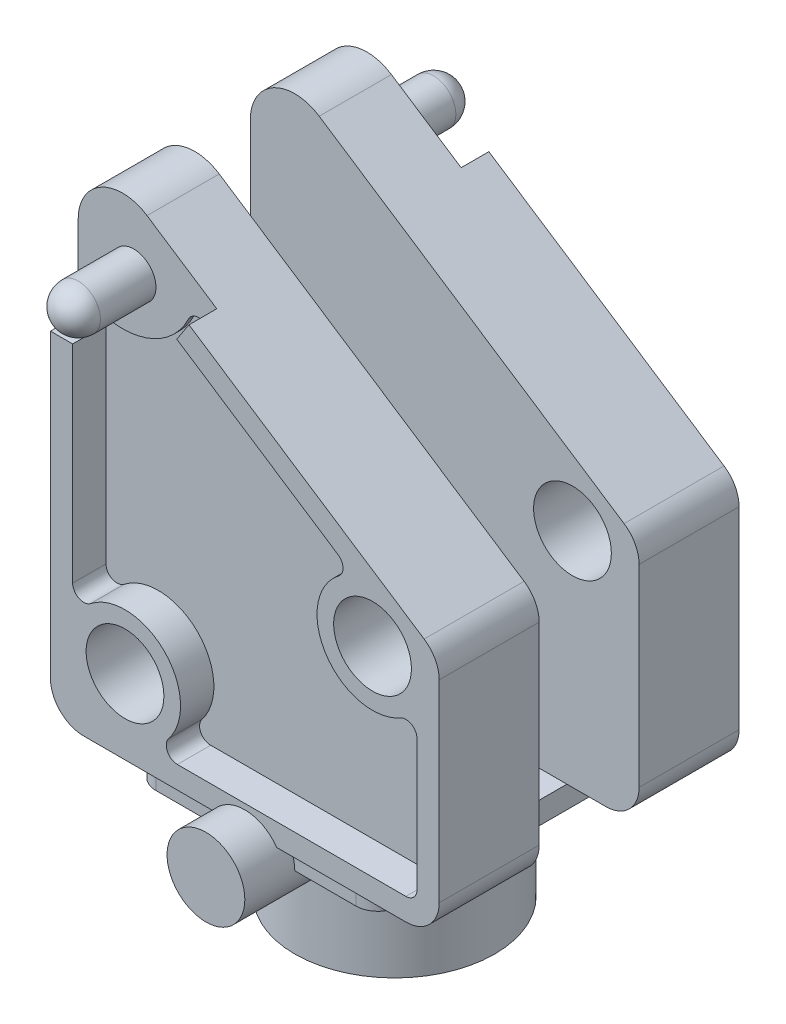
from build123d import *

# Parameters (mm, degrees)
BOSS_EXTRUDE1_DEPTH            = 22
SKETCH2_W                      = 35
SKETCH2_H                      = 22
BOSS_EXTRUDE2_DEPTH            = 24
BOSS_EXTRUDE3_DEPTH            = 1.5
BOSS_EXTRUDE4_START            = 2.5
BOSS_EXTRUDE4_DEPTH            = 2.5
CUT_EXTRUDE1_DEPTH             = 9
SKETCH6_W                      = 35
SKETCH6_H                      = 0.8
CUT_EXTRUDE2_DEPTH             = 2
SKETCH7_W                      = 2
SKETCH7_H                      = 1.5
CUT_EXTRUDE3_DEPTH             = 7.510590912
SKETCH8_W                      = 1.5
SKETCH8_H                      = 2
CUT_EXTRUDE4_DEPTH             = 7.510590912
SKETCH9_W                      = 2
SKETCH9_H                      = 2.5
CUT_EXTRUDE5_DEPTH             = 7.510590912
SKETCH10_W                     = 2.5
SKETCH10_H                     = 2
CUT_EXTRUDE6_DEPTH             = 7.510590912
CUT_EXTRUDE7_DEPTH             = 6.5
CUT_EXTRUDE8_DEPTH             = 6.5
BOSS_EXTRUDE5_DEPTH            = 1
CUT_EXTRUDE9_DEPTH             = 0.5
CUT_EXTRUDE10_START            = -0.5
CUT_EXTRUDE10_DEPTH            = 0.5
SKETCH16_R                     = 9
BOSS_EXTRUDE6_DEPTH            = 10
F_17_0_17_DIAMETER_HOLE1_D     = 17
F_17_0_17_DIAMETER_HOLE1_DEPTH = 10
BOSS_EXTRUDE7_REACH            = 61.982
BOSS_EXTRUDE7_END_RADIUS       = 8.5
SKETCH22_W                     = 3.5
SKETCH22_H                     = 8.5
F_7_0_7_DIAMETER_HOLE1_D       = 7
F_7_0_7_DIAMETER_HOLE1_DEPTH   = 9
F_7_0_7_DIAMETER_HOLE2_D       = 7
F_7_0_7_DIAMETER_HOLE2_DEPTH   = 13.5
FILLET1_R                      = 1
FILLET2_R                      = 2
FILLET3_R                      = 3


# Read off the part's stored shape, not the designer's step: Boss-Extrude8, Boss-Extrude9
with BuildPart() as part:
    # Sketch1 → Boss-Extrude1 (new body)
    with BuildSketch(Plane.XY.offset(11)):
        with BuildLine():
            Line((-17.5, 34), (17.5, 34))
            Line((17.5, 34), (-11.303288453, 52.927875269))
            ThreePointArc((-11.303288453, 52.927875269), (-15.399098972, 53.105482741), (-17.5, 49.585053351))
            Line((-17.5, 49.585053351), (-17.5, 34))
        make_face()
    extrude(amount=-BOSS_EXTRUDE1_DEPTH)

    # Sketch2 → Boss-Extrude2 (add)
    with BuildSketch(Plane.XZ.offset(-34)):
        Rectangle(SKETCH2_W, SKETCH2_H)
    extrude(amount=BOSS_EXTRUDE2_DEPTH)

    # Sketch3 → Boss-Extrude3 (add)
    with BuildSketch(Plane.XY.offset(11)):
        with BuildLine():
            Line((17.5, 10), (-17.5, 10))
            Line((-17.5, 10), (-17.5, 49.585053351))
            Line((-17.5, 49.585053351), (-15.5, 49.585053351))
            Line((-15.5, 49.585053351), (-15.5, 23.426149773))
            ThreePointArc((-15.5, 23.426149773), (-14.936551363, 22.526470437), (-13.881154186, 22.640637292))
            ThreePointArc((-13.881154186, 22.640637292), (-7.251391207, 22.248608793), (-6.859362708, 15.618845814))
            ThreePointArc((-6.859362708, 15.618845814), (-6.973529563, 14.563448637), (-6.073850227, 14))
            Line((-6.073850227, 14), (15.5, 14))
            Line((15.5, 14), (15.5, 26.803847577))
            ThreePointArc((15.5, 26.803847577), (15, 27.669872981), (14, 27.669872981))
            ThreePointArc((14, 27.669872981), (7.344042027, 29.220069546), (8.452225776, 35.963719501))
            ThreePointArc((8.452225776, 35.963719501), (8.841984311, 36.793514293), (8.391848818, 37.592168881))
            Line((8.391848818, 37.592168881), (-12.401644227, 51.25646431))
            Line((-12.401644227, 51.25646431), (-11.303288453, 52.927875269))
            Line((-11.303288453, 52.927875269), (17.5, 34))
            Line((17.5, 34), (17.5, 10))
        make_face()
    extrude(amount=BOSS_EXTRUDE3_DEPTH)

    # Sketch4 → Boss-Extrude4 (add)
    with BuildSketch(Plane(origin=(0, 0, -11), x_dir=(-1, 0, 0), z_dir=(0, 0, -1)).offset(BOSS_EXTRUDE4_START)):
        with BuildLine():
            Line((12.401644227, 51.25646431), (-8.391848818, 37.592168881))
            ThreePointArc((-8.391848818, 37.592168881), (-8.841984311, 36.793514293), (-8.452225776, 35.963719501))
            ThreePointArc((-8.452225776, 35.963719501), (-7.344042027, 29.220069546), (-14, 27.669872981))
            ThreePointArc((-14, 27.669872981), (-15, 27.669872981), (-15.5, 26.803847577))
            Line((-15.5, 26.803847577), (-15.5, 14))
            Line((-15.5, 14), (6.073850227, 14))
            ThreePointArc((6.073850227, 14), (6.973529563, 14.563448637), (6.859362708, 15.618845814))
            ThreePointArc((6.859362708, 15.618845814), (7.251391207, 22.248608793), (13.881154186, 22.640637292))
            ThreePointArc((13.881154186, 22.640637292), (14.936551363, 22.526470437), (15.5, 23.426149773))
            Line((15.5, 23.426149773), (15.5, 49.585053351))
            Line((15.5, 49.585053351), (17.5, 49.585053351))
            Line((17.5, 49.585053351), (17.5, 10))
            Line((17.5, 10), (-17.5, 10))
            Line((-17.5, 10), (-17.5, 34))
            Line((-17.5, 34), (11.303288453, 52.927875269))
            Line((11.303288453, 52.927875269), (12.401644227, 51.25646431))
        make_face()
    extrude(amount=-BOSS_EXTRUDE4_DEPTH)

    # Sketch5 → Cut-Extrude1 (cut)
    with BuildSketch(Plane.XY.offset(4.5)):
        with BuildLine():
            Line((-17.5, 49.585053351), (-17.5, 12))
            Line((-17.5, 12), (17.5, 12))
            Line((17.5, 12), (17.5, 34))
            Line((17.5, 34), (-11.303288453, 52.927875269))
            ThreePointArc((-11.303288453, 52.927875269), (-15.399098972, 53.105482741), (-17.5, 49.585053351))
        make_face()
    extrude(amount=-CUT_EXTRUDE1_DEPTH, mode=Mode.SUBTRACT)

    # Sketch6 → Cut-Extrude2 (cut)
    with BuildSketch(Plane.XZ.offset(-10)):
        with Locations((0, -13.1)):
            Rectangle(SKETCH6_W, SKETCH6_H)
    extrude(amount=-CUT_EXTRUDE2_DEPTH, mode=Mode.SUBTRACT)

    # Sketch7 → Cut-Extrude3 (cut)
    with BuildSketch(Plane(origin=(0, 49.585053351, 0), x_dir=(-1, 0, 0), z_dir=(0, 1, 0))):
        with Locations((16.5, 11.75)):
            Rectangle(SKETCH7_W, SKETCH7_H)
    extrude(amount=-CUT_EXTRUDE3_DEPTH, mode=Mode.SUBTRACT)

    # Sketch8 → Cut-Extrude4 (cut)
    with BuildSketch(Plane(origin=(-32.185557553, 21.150509249, 0), x_dir=(0, 0, 1), z_dir=(-0.8357054797012744, 0.5491778866608367, 0))):
        with Locations((11.75, 37.024599326)):
            Rectangle(SKETCH8_W, SKETCH8_H)
    extrude(amount=-CUT_EXTRUDE4_DEPTH, mode=Mode.SUBTRACT)

    # Sketch9 → Cut-Extrude5 (cut)
    with BuildSketch(Plane(origin=(0, 49.585053351, 0), x_dir=(-1, 0, 0), z_dir=(0, 1, 0))):
        with Locations((16.5, -12.25)):
            Rectangle(SKETCH9_W, SKETCH9_H)
    extrude(amount=-CUT_EXTRUDE5_DEPTH, mode=Mode.SUBTRACT)

    # Sketch10 → Cut-Extrude6 (cut)
    with BuildSketch(Plane(origin=(-32.185557553, 21.150509249, 0), x_dir=(0, 0, 1), z_dir=(-0.8357054797012744, 0.5491778866608367, 0))):
        with Locations((-12.25, 37.024599326)):
            Rectangle(SKETCH10_W, SKETCH10_H)
    extrude(amount=-CUT_EXTRUDE6_DEPTH, mode=Mode.SUBTRACT)

    # Sketch11 → Cut-Extrude7 (cut)
    with BuildSketch(Plane(origin=(17.5, 0, 0), x_dir=(0, 0, -1), z_dir=(1, 0, 0))):
        Polygon((-12.5, 10), (12.7, 10), (12.7, 12), (4.5, 12), (-4.5, 12), (-12.5, 12), align=None)
    extrude(amount=-CUT_EXTRUDE7_DEPTH, mode=Mode.SUBTRACT)

    # Sketch12 → Cut-Extrude8 (cut)
    with BuildSketch(Plane.ZY.offset(17.5)):
        Polygon((-4.5, 12), (-12.7, 12), (-12.7, 10), (12.5, 10), (12.5, 12), (4.5, 12), align=None)
    extrude(amount=-CUT_EXTRUDE8_DEPTH, mode=Mode.SUBTRACT)

    # Sketch13 → Boss-Extrude5 (add)
    with BuildSketch(Plane.XY.offset(12.5)):
        with BuildLine():
            Line((17.5, 12), (-17.5, 12))
            Line((-17.5, 12), (-17.5, 42.074462439))
            Line((-17.5, 42.074462439), (-15.5, 42.074462439))
            Line((-15.5, 42.074462439), (-15.5, 23.426149773))
            ThreePointArc((-15.5, 23.426149773), (-14.936551363, 22.526470437), (-13.881154186, 22.640637292))
            ThreePointArc((-13.881154186, 22.640637292), (-7.251391207, 22.248608793), (-6.859362708, 15.618845814))
            ThreePointArc((-6.859362708, 15.618845814), (-6.973529563, 14.563448637), (-6.073850227, 14))
            Line((-6.073850227, 14), (15.5, 14))
            Line((15.5, 14), (15.5, 26.803847577))
            ThreePointArc((15.5, 26.803847577), (15, 27.669872981), (14, 27.669872981))
            ThreePointArc((14, 27.669872981), (7.344042027, 29.220069546), (8.452225776, 35.963719501))
            ThreePointArc((8.452225776, 35.963719501), (8.841984311, 36.793514293), (8.391848818, 37.592168881))
            Line((8.391848818, 37.592168881), (-6.125002246, 47.131813865))
            Line((-6.125002246, 47.131813865), (-5.026646473, 48.803224825))
            Line((-5.026646473, 48.803224825), (17.5, 34))
            Line((17.5, 34), (17.5, 12))
        make_face()
    extrude(amount=BOSS_EXTRUDE5_DEPTH)

    # Sketch14 → Cut-Extrude9 (cut)
    with BuildSketch(Plane(origin=(0, 0, -11), x_dir=(-1, 0, 0), z_dir=(0, 0, -1))):
        with BuildLine():
            Line((6.125002246, 47.131813865), (-8.391848818, 37.592168881))
            ThreePointArc((-8.391848818, 37.592168881), (-8.841984311, 36.793514293), (-8.452225776, 35.963719501))
            ThreePointArc((-8.452225776, 35.963719501), (-7.344042027, 29.220069546), (-14, 27.669872981))
            ThreePointArc((-14, 27.669872981), (-15, 27.669872981), (-15.5, 26.803847577))
            Line((-15.5, 26.803847577), (-15.5, 14))
            Line((-15.5, 14), (6.073850227, 14))
            ThreePointArc((6.073850227, 14), (6.973529563, 14.563448637), (6.859362708, 15.618845814))
            ThreePointArc((6.859362708, 15.618845814), (7.251391207, 22.248608793), (13.881154186, 22.640637292))
            ThreePointArc((13.881154186, 22.640637292), (14.936551363, 22.526470437), (15.5, 23.426149773))
            Line((15.5, 23.426149773), (15.5, 42.074462439))
            ThreePointArc((15.5, 42.074462439), (15.158794125, 42.826785707), (14.368019399, 43.065714738))
            ThreePointArc((14.368019399, 43.065714738), (10.377467708, 43.796700761), (7.575055938, 46.730185317))
            ThreePointArc((7.575055938, 46.730185317), (6.941105645, 47.259825549), (6.125002246, 47.131813865))
        make_face()
    extrude(amount=-CUT_EXTRUDE9_DEPTH, mode=Mode.SUBTRACT)

    # Sketch15 → Cut-Extrude10 (cut)
    with BuildSketch(Plane.XY.offset(11).offset(CUT_EXTRUDE10_START)):
        with BuildLine():
            Line((-15.5, 42.074462439), (-15.5, 23.426149773))
            ThreePointArc((-15.5, 23.426149773), (-14.936551363, 22.526470437), (-13.881154186, 22.640637292))
            ThreePointArc((-13.881154186, 22.640637292), (-7.251391207, 22.248608793), (-6.859362708, 15.618845814))
            ThreePointArc((-6.859362708, 15.618845814), (-6.973529563, 14.563448637), (-6.073850227, 14))
            Line((-6.073850227, 14), (15.5, 14))
            Line((15.5, 14), (15.5, 26.803847577))
            ThreePointArc((15.5, 26.803847577), (15, 27.669872981), (14, 27.669872981))
            ThreePointArc((14, 27.669872981), (7.344042027, 29.220069546), (8.452225776, 35.963719501))
            ThreePointArc((8.452225776, 35.963719501), (8.841984311, 36.793514293), (8.391848818, 37.592168881))
            Line((8.391848818, 37.592168881), (-6.125002246, 47.131813865))
            ThreePointArc((-6.125002246, 47.131813865), (-6.941105645, 47.259825549), (-7.575055938, 46.730185317))
            ThreePointArc((-7.575055938, 46.730185317), (-10.377467708, 43.796700761), (-14.368019399, 43.065714738))
            ThreePointArc((-14.368019399, 43.065714738), (-15.158794125, 42.826785707), (-15.5, 42.074462439))
        make_face()
    extrude(amount=CUT_EXTRUDE10_DEPTH, mode=Mode.SUBTRACT)

    # Sketch16 → Boss-Extrude6 (add)
    with BuildSketch(Plane.XZ.offset(-10)):
        with Locations(Location((0, 0, 0), (0, 0, 270))):
            Circle(SKETCH16_R)
    extrude(amount=BOSS_EXTRUDE6_DEPTH)

    # Ø17.0 (17) Diameter Hole1
    with Locations(Plane(origin=(0, 0, 0), x_dir=(-1, 0, 0), z_dir=(0, -1, 0))):
        with Locations((0, 0)):
            Hole(F_17_0_17_DIAMETER_HOLE1_D / 2, depth=F_17_0_17_DIAMETER_HOLE1_DEPTH)

    # Boss-Extrude7: up to this cylinder (the profile starts inside it)
    boss_extrude7_end = Plane(origin=(0, 8.514554, 0), z_dir=(0, -1, 0)) * Cylinder(BOSS_EXTRUDE7_END_RADIUS, 141.964, mode=Mode.PRIVATE)
    # Sketch19 → Boss-Extrude7 (add, up to the surface)
    with BuildSketch(Plane(origin=(0, 0, 7), x_dir=(-1, 0, 0), z_dir=(0, 0, -1)), mode=Mode.PRIVATE) as boss_extrude7_sk1:
        with BuildLine():
            Line((3.5, 10), (-3.5, 10))
            ThreePointArc((-3.5, 10), (0, 6.5), (3.5, 10))
        make_face()
    boss_extrude7_tool1 = extrude(boss_extrude7_sk1.sketch, amount=-BOSS_EXTRUDE7_REACH, mode=Mode.PRIVATE) & boss_extrude7_end
    add(boss_extrude7_tool1.solids().sort_by_distance((0, 8.514554, 7))[0])

    # Boss-Extrude8 outline → Boss-Extrude8 (revolve)
    with BuildSketch(Plane(origin=(-12.5, 47.731316688, 0), x_dir=(1, 0, 0), z_dir=(0, -1, 0))):
        with BuildLine():
            ThreePointArc((0, -18), (1.414213563, -17.414213562), (2, -15.999999998))
            Line((2, -15.999999998), (2, -11))
            Line((2, -11), (0, -11))
            Line((0, -11), (0, -18))
        make_face()
    revolve(axis=Axis((-12.5, 47.731316688, 0), (0, 0, 1)))

    # Boss-Extrude9 outline → Boss-Extrude9 (revolve)
    with BuildSketch(Plane(origin=(-12.5, 47.731316688, 0), x_dir=(1, 0, 0), z_dir=(0, -1, 0))):
        with BuildLine():
            Line((2, 11), (2, 15.999999998))
            ThreePointArc((2, 15.999999998), (1.414213563, 17.414213562), (0, 18))
            Line((0, 18), (0, 11))
            Line((0, 11), (2, 11))
        make_face()
    revolve(axis=Axis((-12.5, 47.731316688, 0), (0, 0, 1)))

    # Sketch22 → Revolve1 (revolve)
    with BuildSketch(Plane(origin=(0, 10, 0), x_dir=(1, 0, 0), z_dir=(0, 1, 0))):
        with Locations((1.75, -12.75)):
            Rectangle(SKETCH22_W, SKETCH22_H)
    revolve(axis=Axis((0, 10, 8.5), (0, 0, 1)))

    # Ø7.0 (7) Diameter Hole1
    with Locations(Plane.XY.offset(13.5)):
        with Locations((-10.786925113, 18.713074887), (11.5, 32)):
            Hole(F_7_0_7_DIAMETER_HOLE1_D / 2, depth=F_7_0_7_DIAMETER_HOLE1_DEPTH)

    # Ø7.0 (7) Diameter Hole2
    with Locations(Plane.XY.offset(-4.5)):
        with Locations((-10.786925113, 18.713074887), (11.5, 32)):
            Hole(F_7_0_7_DIAMETER_HOLE2_D / 2, depth=F_7_0_7_DIAMETER_HOLE2_DEPTH)

    # Fillet1
    fillet1_edges = [part.edges().sort_by_distance(p)[0] for p in [
        (15.5, 14, 12),
        (15.5, 14, -12),
    ]]
    fillet(fillet1_edges, radius=FILLET1_R)

    # Fillet2
    fillet2_edges = [part.edges().sort_by_distance(p)[0] for p in [
        (11, 11, 12.5),
        (11, 11, -12.7),
        (-11, 11, 12.5),
        (-11, 11, -12.7),
    ]]
    fillet(fillet2_edges, radius=FILLET2_R)

    # Fillet3
    fillet3_edges = [part.edges().sort_by_distance(p)[0] for p in [
        (17.5, 34, 9),
        (-17.5, 12, -9),
        (17.5, 12, -9),
        (17.5, 12, 9),
        (-17.5, 12, 9),
        (17.5, 34, -9),
    ]]
    fillet(fillet3_edges, radius=FILLET3_R)


solid = part.part
